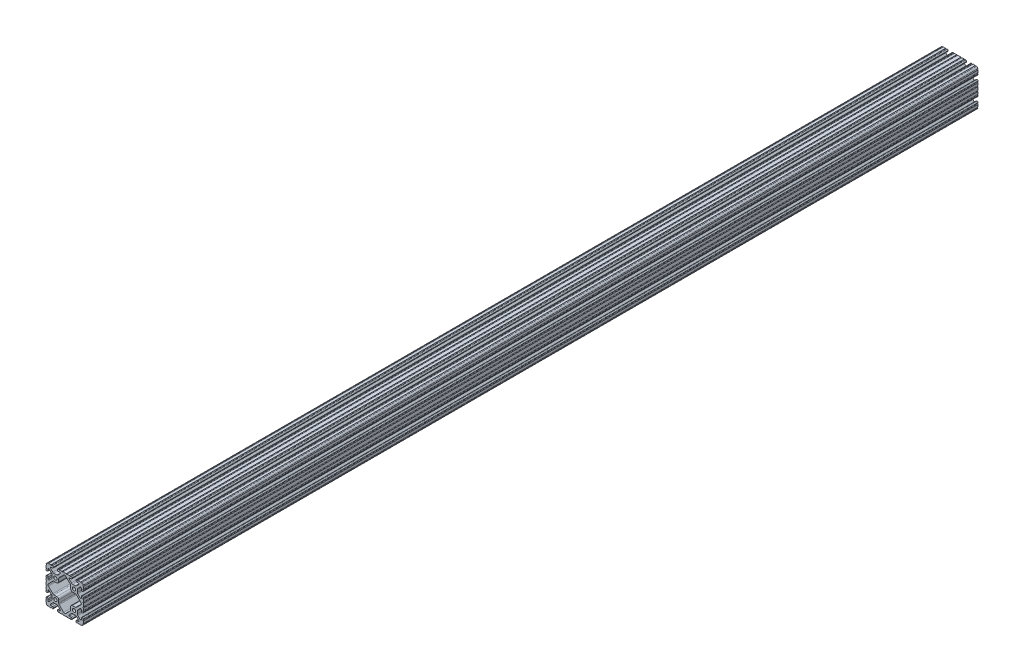
from build123d import *

# Parameters (mm, degrees)
BOSS_EXTRUDE1_DEPTH     = 914.4
CUT_EXTRUDE1_DEPTH      = 916.986124349
CUT_EXTRUDE1_DEPTH_BACK = 916.986124349
SKETCH5_R               = 1.016
BOSS_EXTRUDE2_DEPTH     = 914.4
CUT_EXTRUDE2_DEPTH      = 916.986124349
CUT_EXTRUDE2_DEPTH_BACK = 916.986124349


with BuildPart() as part:
    # Sketch4 → Boss-Extrude1 (new, symmetric)
    with BuildSketch(Plane.XY):
        with BuildLine():
            Line((24.8412, -38.1), (33.3502, -38.1))
            ThreePointArc((33.3502, -38.1), (36.708815789, -36.708815789), (38.1, -33.3502))
            Line((38.1, -33.3502), (38.1, -24.8412))
            ThreePointArc((38.1, -24.8412), (37.594114832, -23.619885168), (36.3728, -23.114))
            Line((36.3728, -23.114), (35.7632, -23.114))
            ThreePointArc((35.7632, -23.114), (34.541885168, -23.619885168), (34.036, -24.8412))
            Line((34.036, -24.8412), (34.036, -28.046305235))
            ThreePointArc((34.036, -28.046305235), (33.239232738, -29.238751711), (31.832646215, -28.958964256))
            Line((31.832646215, -28.958964256), (26.938897763, -24.065215804))
            ThreePointArc((26.938897763, -24.065215804), (26.269915375, -23.064012907), (26.035, -21.883013566))
            Line((26.035, -21.883013566), (26.035, -19.05))
            Line((26.035, -19.05), (22.3774, -19.05))
            ThreePointArc((22.3774, -19.05), (21.402827104, -21.402827104), (19.05, -22.3774))
            Line((19.05, -22.3774), (19.05, -26.035))
            Line((19.05, -26.035), (21.883013566, -26.035))
            ThreePointArc((21.883013566, -26.035), (23.064012907, -26.269915375), (24.065215804, -26.938897763))
            Line((24.065215804, -26.938897763), (28.958964256, -31.832646215))
            ThreePointArc((28.958964256, -31.832646215), (29.238751711, -33.239232738), (28.046305235, -34.036))
            Line((28.046305235, -34.036), (24.8412, -34.036))
            ThreePointArc((24.8412, -34.036), (23.619885168, -34.541885168), (23.114, -35.7632))
            Line((23.114, -35.7632), (23.114, -36.3728))
            ThreePointArc((23.114, -36.3728), (23.619885168, -37.594114832), (24.8412, -38.1))
        make_face()
    extrude(amount=BOSS_EXTRUDE1_DEPTH, both=True)

    # Sketch5 → Cut-Extrude1 (cut, two sides: drawn at the far end of the back side and taken through both)
    with BuildSketch(Plane.XY.offset(-CUT_EXTRUDE1_DEPTH_BACK)):
        with Locations((33.789477062, -38.1)):
            Circle(SKETCH5_R)
        with Locations((27.030305235, -38.1)):
            Circle(SKETCH5_R)
        with Locations((38.1, -33.789477062)):
            Circle(SKETCH5_R)
        with Locations((38.1, -27.030305235)):
            Circle(SKETCH5_R)
    extrude(amount=CUT_EXTRUDE1_DEPTH + CUT_EXTRUDE1_DEPTH_BACK, mode=Mode.SUBTRACT)

    # Mirror1: part across plane


with BuildPart() as part_1:
    add(part.part)
    add(part.part.mirror(Plane(origin=(26.035, -19.05, 914.4), x_dir=(0, 0, 1), z_dir=(0, -1, 0))))

    # Mirror4: part across plane


with BuildPart() as part_2:
    add(part_1.part)
    add(part_1.part.mirror(Plane(origin=(19.05, -12.065, 914.4), x_dir=(0, 0, 1), z_dir=(1, 0, 0))))

    # Sketch6 → Boss-Extrude2 (add, symmetric)
    with BuildSketch(Plane.XY):
        with BuildLine():
            Line((38.1, -3.294522938), (38.1, 0))
            Line((38.1, 0), (32.773477062, 0))
            Line((32.773477062, 0), (32.773477062, -4.310522938))
            Line((32.773477062, -4.310522938), (37.084, -4.310522938))
            ThreePointArc((37.084, -4.310522938), (37.38157951, -3.592102448), (38.1, -3.294522938))
        make_face()
        with BuildLine():
            Line((0, -32.773477062), (4.310522938, -32.773477062))
            Line((4.310522938, -32.773477062), (4.310522938, -37.084))
            ThreePointArc((4.310522938, -37.084), (3.592102448, -37.38157951), (3.294522938, -38.1))
            Line((3.294522938, -38.1), (0, -38.1))
            Line((0, -38.1), (0, -32.773477062))
        make_face()
    extrude(amount=BOSS_EXTRUDE2_DEPTH, both=True)

    # Sketch7 → Cut-Extrude2 (cut, two sides: drawn at the far end of the back side and taken through both)
    with BuildSketch(Plane.XY.offset(-CUT_EXTRUDE2_DEPTH_BACK)):
        with BuildLine():
            Line((26.51209003, -8.714228011), (33.194318041, -2.032))
            ThreePointArc((33.194318041, -2.032), (33.817253986, -1.099710475), (34.036, 0))
            Line((34.036, 0), (19.05, 0))
            Line((19.05, 0), (26.51209003, -8.714228011))
        make_face()
        with BuildLine():
            Line((12.065, -16.096768927), (12.065, -21.883013566))
            ThreePointArc((12.065, -21.883013566), (11.830084625, -23.064012907), (11.161102237, -24.065215804))
            Line((11.161102237, -24.065215804), (2.032, -33.194318041))
            ThreePointArc((2.032, -33.194318041), (1.099710475, -33.817253986), (0, -34.036))
            Line((0, -34.036), (0, 0))
            Line((0, 0), (16.096768927, 0))
            Line((16.096768927, 0), (16.096768927, -12.065))
            ThreePointArc((16.096768927, -12.065), (13.245877779, -13.245877779), (12.065, -16.096768927))
        make_face()
    extrude(amount=CUT_EXTRUDE2_DEPTH + CUT_EXTRUDE2_DEPTH_BACK, mode=Mode.SUBTRACT)

    # Mirror2: part across plane


with BuildPart() as part_3:
    add(part_2.part)
    add(part_2.part.mirror(Plane.ZX))

    # Mirror3: part across plane


with BuildPart() as part_4:
    add(part_3.part)
    add(part_3.part.mirror(Plane(origin=(0, 0, 0), x_dir=(0, 0, 1), z_dir=(1, 0, 0))))


solid = part_4.part
